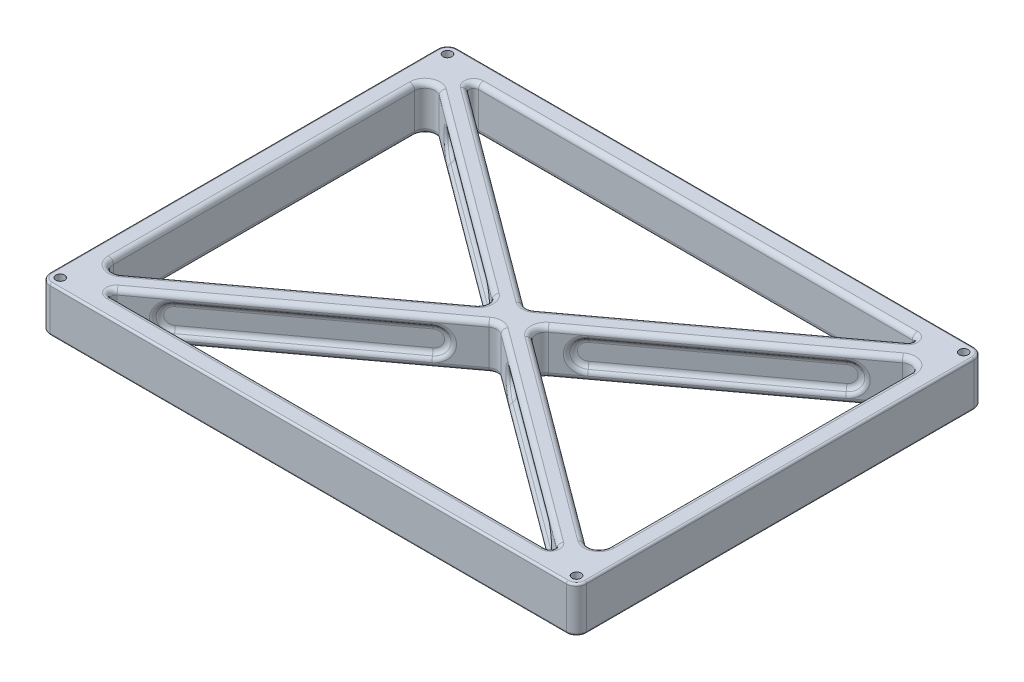
from build123d import *

# Parameters (mm, degrees)
SKETCH1_W           = 264
SKETCH1_H           = 200.50000000000003
SKETCH1_R           = 2.200000000000014
SKETCH1_R_2         = 2.1999999999999966
SKETCH1_W_2         = 244
SKETCH1_H_2         = 180.49999999999997
BOSS_EXTRUDE1_DEPTH = 22.2504
FILLET1_R           = 5
FILLET2_R           = 1
FILLET4_R           = 2.25
FILLET3_R           = 2.5
CUT_EXTRUDE3_DEPTH  = 2.5
CUT_EXTRUDE4_START  = -7.5
CUT_EXTRUDE4_DEPTH  = 2.5
CUT_EXTRUDE5_DEPTH  = 2.5
CUT_EXTRUDE6_START  = -7.5
CUT_EXTRUDE6_DEPTH  = 2.5
FILLET6_R           = 2.5
FILLET7_R           = 3


# Some blends are built 0.0001 mm under size
with BuildPart() as part:
    # Sketch1 → Boss-Extrude1 (new body)
    # profile 1 of 6: a face of its own
    with BuildSketch(Plane(origin=(0, 0, 0), x_dir=(1, 0, 0), z_dir=(0, 1, 0))):
        Rectangle(SKETCH1_W, SKETCH1_H)
        with Locations(Location((-127.00000000000003, 95.24999999999997, 0), (0, 0, 90))):
            Circle(SKETCH1_R, mode=Mode.SUBTRACT)
        with Locations(Location((126.99999999999997, 95.25, 0), (0, 0, 90))):
            Circle(SKETCH1_R, mode=Mode.SUBTRACT)
        with Locations(Location((126.99999999999997, -95.24999999999997, 0), (0, 0, 90))):
            Circle(SKETCH1_R, mode=Mode.SUBTRACT)
        with Locations(Location((-127.00000000000003, -95.25, 0), (0, 0, 90))):
            Circle(SKETCH1_R_2, mode=Mode.SUBTRACT)
        Rectangle(SKETCH1_W_2, SKETCH1_H_2, mode=Mode.SUBTRACT)
    # profile 2 of 6: a face of its own
    with BuildSketch(Plane(origin=(0, 0, 0), x_dir=(1, 0, 0), z_dir=(0, 1, 0))):
        Polygon((-121.99999999999999, 90.25), (-121.99999999999999, 84.0306026697892), (-8.40738475662856, 1.1369e-13), (-1.421e-14, 6.219397330210882), (-113.59261524337134, 90.24999999999999), align=None)
    # profile 3 of 6: a face of its own
    with BuildSketch(Plane(origin=(0, 0, 0), x_dir=(1, 0, 0), z_dir=(0, 1, 0))):
        Polygon((8.40738475662856, -2.842e-14), (9.948e-14, -6.219397330210853), (113.59261524337164, -90.24999999999999), (122.00000000000003, -90.24999999999997), (122.00000000000003, -84.03060266978919), align=None)
    # profile 4 of 6: a face of its own
    with BuildSketch(Plane(origin=(0, 0, 0), x_dir=(1, 0, 0), z_dir=(0, 1, 0))):
        Polygon((9.948e-14, -6.219397330210825), (-8.40738475662856, 1.1369e-13), (-121.99999999999999, -84.03060266978906), (-121.99999999999999, -90.24999999999997), (-113.59261524337128, -90.24999999999997), align=None)
    # profile 5 of 6: a face of its own
    with BuildSketch(Plane(origin=(0, 0, 0), x_dir=(1, 0, 0), z_dir=(0, 1, 0))):
        Polygon((113.59261524337147, 90.25), (-1.421e-14, 6.219397330210882), (8.407384756628616, -4.263e-14), (122.00000000000001, 84.03060266978915), (122.00000000000003, 90.25), align=None)
    # profile 6 of 6: a face of its own
    with BuildSketch(Plane(origin=(0, 0, 0), x_dir=(1, 0, 0), z_dir=(0, 1, 0))):
        Polygon((-1.421e-14, 6.219397330210882), (-8.407384756628531, 2.842e-14), (9.948e-14, -6.219397330210825), (8.40738475662856, -2.842e-14), align=None)
    extrude(amount=BOSS_EXTRUDE1_DEPTH)

    # Fillet1
    fillet1_edges = [part.edges().sort_by_distance(p)[0] for p in [
        (-132, 11.1252, -100.25),
        (132, 11.1252, -100.25),
        (132, 11.1252, 100.25),
        (-132, 11.1252, 100.25),
        (122.00000000000003, 11.1252, 84.03060266978919),
        (122.00000000000003, 11.1252, -84.03060266978915),
        (8.407384756628588, 11.1252, 3.553e-14),
        (7.11e-15, 11.1252, -6.2193973302108745),
        (-121.99999999999999, 11.1252, -84.0306026697892),
        (-121.99999999999999, 11.1252, 84.03060266978906),
        (-8.407384756628545, 11.1252, -7.105e-14),
        (9.948e-14, 11.1252, 6.219397330210839),
    ]]
    fillet(fillet1_edges, radius=FILLET1_R)

    # Fillet2
    fillet2_edges = [part.edges().sort_by_distance(p)[0] for p in [
        (-132, 0, 0),
        (-132, 22.2504, 0),
        (0, 0, -100.25),
        (132, 0, 0),
        (0, 0, 100.25),
        (-130.53553390593274, 0, 98.78553390593274),
        (130.53553390593274, 0, 98.78553390593274),
        (130.53553390593274, 0, -98.78553390593274),
        (-130.53553390593274, 0, -98.78553390593274),
        (0, 22.2504, -100.25),
        (0, 22.2504, 100.25),
        (132, 22.2504, 0),
        (-130.53553390593274, 22.2504, 98.78553390593274),
        (130.53553390593274, 22.2504, 98.78553390593274),
        (130.53553390593274, 22.2504, -98.78553390593274),
        (-130.53553390593274, 22.2504, -98.78553390593274),
    ]]
    fillet(fillet2_edges, radius=FILLET2_R)

    # Fillet4
    fillet4_edges = [part.edges().sort_by_distance(p)[0] for p in [
        (113.59261524337147, 11.1252, -90.25),
        (-113.59261524337134, 11.1252, -90.25),
        (-113.59261524337128, 11.1252, 90.24999999999997),
        (113.59261524337164, 11.1252, 90.24999999999997),
    ]]
    fillet(fillet4_edges, radius=FILLET4_R)

    # Fillet3
    fillet3_edges = [part.edges().sort_by_distance(p)[0] for p in [
        (1.4288e-13, 22.2504, 7.438794660421738),
        (-11.814769513257094, 0, -5.125e-14),
        (-11.814769513257094, 22.2504, -5.125e-14),
        (-2.225e-14, 0, -7.438794660421792),
        (-2.225e-14, 22.2504, -7.438794660421792),
        (119.25079080925714, 0, 78.57717904346684),
        (119.25079080925714, 22.2504, 78.57717904346684),
        (-119.25079080925708, 0, 78.57717904346667),
        (-119.25079080925708, 22.2504, 78.57717904346667),
        (119.25079080925715, 0, -78.5771790434668),
        (119.25079080925715, 22.2504, -78.5771790434668),
        (-119.25079080925708, 0, -78.57717904346683),
        (-119.25079080925708, 22.2504, -78.57717904346683),
        (1.279e-13, 0, 90.24999999999997),
        (1.279e-13, 22.2504, 90.24999999999997),
        (-55.539713240734955, 0, 47.3051278218202),
        (-55.539713240734955, 22.2504, 47.3051278218202),
        (55.53971324073509, 0, -47.305127821820236),
        (55.53971324073509, 22.2504, -47.305127821820236),
        (2.842e-14, 0, -90.25),
        (2.842e-14, 22.2504, -90.25),
        (108.9046110099341, 0, 88.70447565375049),
        (108.9046110099341, 22.2504, 88.70447565375049),
        (-108.90461100993383, 0, 88.70447565375048),
        (-108.90461100993383, 22.2504, 88.70447565375048),
        (108.90461100993397, 0, -88.7044756537505),
        (108.90461100993397, 22.2504, -88.7044756537505),
        (-108.9046110099339, 0, -88.70447565375054),
        (-108.9046110099339, 22.2504, -88.70447565375054),
        (63.933808463443114, 0, -41.07589950442634),
        (63.933808463443114, 22.2504, -41.07589950442634),
        (63.93380846344311, 0, 41.07589950442636),
        (63.93380846344311, 22.2504, 41.07589950442636),
        (55.53971324073523, 0, 47.3051278218202),
        (55.53971324073523, 22.2504, 47.3051278218202),
        (-63.933808463443036, 0, 41.07589950442625),
        (-63.933808463443036, 22.2504, 41.07589950442625),
        (-63.93380846344305, 0, -41.07589950442639),
        (-63.93380846344305, 22.2504, -41.07589950442639),
        (-55.539713240735054, 0, -47.30512782182024),
        (-55.539713240735054, 22.2504, -47.30512782182024),
        (122.00000000000003, 0, 2.842e-14),
        (122.00000000000003, 22.2504, 2.842e-14),
        (-121.99999999999999, 0, -7.105e-14),
        (-121.99999999999999, 22.2504, -7.105e-14),
        (11.814769513257168, 0, -1.169e-14),
        (11.814769513257168, 22.2504, -1.169e-14),
        (1.4288e-13, 0, 7.438794660421738),
    ]]
    fillet(fillet3_edges, radius=FILLET3_R)

    # Sketch3 → Cut-Extrude3 (cut)
    with BuildSketch(Plane(origin=(-2.973576293185441, 0, 4.019682080538768), x_dir=(0.8039364161077707, 0, 0.5947152586371007), z_dir=(-0.5947152586371007, 0, 0.8039364161077707))):
        with BuildLine():
            Line((-118.13635654332894, 4.999999999999997), (-27.397540983606554, 5.000000000000006))
            ThreePointArc((-27.397540983606554, 5.000000000000006), (-21.27234098360655, 11.12520000000001), (-27.397540983606554, 17.250400000000017))
            Line((-27.397540983606554, 17.250400000000017), (-118.13635654332894, 17.250400000000003))
            ThreePointArc((-118.13635654332894, 17.250400000000003), (-124.26155654332895, 11.1252), (-118.13635654332894, 4.999999999999997))
        make_face()
        with BuildLine():
            Line((27.397540983606568, 4.999999999999997), (118.16941770004311, 5.000000000000013))
            ThreePointArc((118.16941770004311, 5.000000000000013), (124.2946177000431, 11.12520000000001), (118.16941770004311, 17.25040000000001))
            Line((118.16941770004311, 17.25040000000001), (27.397540983606568, 17.250400000000003))
            ThreePointArc((27.397540983606568, 17.250400000000003), (21.272340983606565, 11.1252), (27.397540983606568, 4.999999999999997))
        make_face()
    extrude(amount=-CUT_EXTRUDE3_DEPTH, mode=Mode.SUBTRACT)

    # Sketch3<3> → Cut-Extrude4 (cut)
    with BuildSketch(Plane(origin=(-2.973576293185441, 0, 4.019682080538768), x_dir=(0.8039364161077707, 0, 0.5947152586371007), z_dir=(-0.5947152586371007, 0, 0.8039364161077707)).offset(CUT_EXTRUDE4_START)):
        with BuildLine():
            Line((-118.13635654332894, 4.999999999999997), (-27.397540983606554, 5.000000000000006))
            ThreePointArc((-27.397540983606554, 5.000000000000006), (-21.27234098360655, 11.12520000000001), (-27.397540983606554, 17.250400000000017))
            Line((-27.397540983606554, 17.250400000000017), (-118.13635654332894, 17.250400000000003))
            ThreePointArc((-118.13635654332894, 17.250400000000003), (-124.26155654332895, 11.1252), (-118.13635654332894, 4.999999999999997))
        make_face()
        with BuildLine():
            Line((27.397540983606568, 4.999999999999997), (118.16941770004311, 5.000000000000013))
            ThreePointArc((118.16941770004311, 5.000000000000013), (124.2946177000431, 11.12520000000001), (118.16941770004311, 17.25040000000001))
            Line((118.16941770004311, 17.25040000000001), (27.397540983606568, 17.250400000000003))
            ThreePointArc((27.397540983606568, 17.250400000000003), (21.272340983606565, 11.1252), (27.397540983606568, 4.999999999999997))
        make_face()
    extrude(amount=-CUT_EXTRUDE4_DEPTH, mode=Mode.SUBTRACT)

    # Sketch4 → Cut-Extrude5 (cut)
    with BuildSketch(Plane(origin=(-2.973576293185498, 0, -4.019682080538846), x_dir=(-0.8039364161077704, 0, 0.5947152586371007), z_dir=(-0.5947152586371008, 0, -0.8039364161077706))):
        with BuildLine():
            Line((-27.397540983606525, 17.250400000000003), (-118.16941770004307, 17.250400000000003))
            ThreePointArc((-118.16941770004307, 17.250400000000003), (-124.29461770004309, 11.125199999999987), (-118.16941770004307, 4.999999999999997))
            Line((-118.16941770004307, 4.999999999999997), (-27.397540983606525, 4.999999999999997))
            ThreePointArc((-27.397540983606525, 4.999999999999997), (-21.272340983606522, 11.125200000000001), (-27.397540983606525, 17.250400000000003))
        make_face()
        with BuildLine():
            Line((27.397540983606458, 5.000000000000006), (118.13635654332884, 5.000000000000019))
            ThreePointArc((118.13635654332884, 5.000000000000019), (124.26155654332884, 11.125200000000017), (118.13635654332884, 17.250400000000017))
            Line((118.13635654332884, 17.250400000000017), (27.397540983606458, 17.250400000000006))
            ThreePointArc((27.397540983606458, 17.250400000000006), (21.272340983606455, 11.125200000000005), (27.397540983606458, 5.000000000000006))
        make_face()
    extrude(amount=-CUT_EXTRUDE5_DEPTH, mode=Mode.SUBTRACT)

    # Sketch4<3> → Cut-Extrude6 (cut)
    with BuildSketch(Plane(origin=(-2.973576293185498, 0, -4.019682080538846), x_dir=(-0.8039364161077704, 0, 0.5947152586371007), z_dir=(-0.5947152586371008, 0, -0.8039364161077706)).offset(CUT_EXTRUDE6_START)):
        with BuildLine():
            Line((-27.397540983606525, 17.250400000000003), (-118.16941770004307, 17.250400000000003))
            ThreePointArc((-118.16941770004307, 17.250400000000003), (-124.29461770004309, 11.125199999999987), (-118.16941770004307, 4.999999999999997))
            Line((-118.16941770004307, 4.999999999999997), (-27.397540983606525, 4.999999999999997))
            ThreePointArc((-27.397540983606525, 4.999999999999997), (-21.272340983606522, 11.125200000000001), (-27.397540983606525, 17.250400000000003))
        make_face()
        with BuildLine():
            Line((27.397540983606458, 5.000000000000006), (118.13635654332884, 5.000000000000019))
            ThreePointArc((118.13635654332884, 5.000000000000019), (124.26155654332884, 11.125200000000017), (118.13635654332884, 17.250400000000017))
            Line((118.13635654332884, 17.250400000000017), (27.397540983606458, 17.250400000000006))
            ThreePointArc((27.397540983606458, 17.250400000000006), (21.272340983606455, 11.125200000000005), (27.397540983606458, 5.000000000000006))
        make_face()
    extrude(amount=-CUT_EXTRUDE6_DEPTH, mode=Mode.SUBTRACT)

    # Fillet6
    fillet6_edges = [part.edges().sort_by_distance(p)[0] for p in [
        (-55.52642370681444, 17.250400000000013, 47.295296834637185),
        (-96.92481413423135, 11.125200000000017, 77.9199258188534),
        (-55.52642370681444, 5.000000000000012, 47.295296834637185),
        (55.53971324073519, 17.250400000000006, 47.30512782182021),
        (96.95139320207268, 11.12520000000001, 77.93958779321946),
        (55.53971324073518, 5.000000000000005, 47.30512782182019),
        (-61.473576293185445, 17.250400000000013, 39.255932673559485),
        (-102.87196672060237, 11.125200000000017, 69.8805616577757),
        (-61.473576293185445, 5.000000000000012, 39.255932673559485),
        (-61.47357629318548, 5.000000000000002, -39.25593267355961),
        (-102.87196672060242, 11.1252, -69.88056165777583),
        (-61.47357629318548, 17.25040000000001, -39.25593267355961),
        (-55.52642370681448, 5.000000000000002, -47.29529683463733),
        (-96.9248141342314, 11.1252, -77.91992581885354),
        (-55.52642370681448, 17.25040000000001, -47.29529683463733),
        (61.486865827106094, 4.999999999999997, -39.265763660742564),
        (102.89854578844363, 11.125200000000001, -69.90022363214185),
        (61.486865827106094, 17.250400000000003, -39.265763660742564),
        (55.53971324073509, 4.999999999999997, -47.305127821820264),
        (96.95139320207261, 11.125200000000001, -77.93958779321954),
        (55.53971324073509, 17.250400000000003, -47.305127821820264),
        (20.075185865768677, 11.1252, 8.631303689343238),
        (61.486865827106186, 5.000000000000005, 39.26576366074249),
        (102.8985457884437, 11.12520000000001, 69.90022363214175),
        (-14.128033279397512, 11.125200000000007, 16.670667850420976),
        (14.12803327939767, 11.1252, 16.670667850420944),
        (-20.07518586576852, 11.125200000000007, 8.63130368934327),
        (-20.075185865768542, 11.12520000000001, -8.6313036893434),
        (-14.128033279397535, 11.12520000000001, -16.670667850421104),
        (20.07518586576858, 11.1252, -8.631303689343293),
        (14.128033279397574, 11.1252, -16.670667850420998),
        (61.48686582710619, 17.250400000000006, 39.26576366074251),
    ]]
    fillet(fillet6_edges, radius=FILLET6_R - 0.0001)  # a hair under: the kernel refuses the full size

    # Fillet7
    # the kernel refuses this fillet: 3 mm, written as the material it adds along each edge
    with BuildSketch(Plane(origin=(-96.46090723806634, 4.999999999999997, -68.24765279584129), x_dir=(-0.5701467288895418, -0.28445772948515635, 0.7707246639836466), z_dir=(0.8039364161077707, 0, 0.5947152586371007))) as fillet7_piece_1:
        with BuildLine():
            CenterArc((2.2759117138170812, -2.876031614211566), FILLET7_R, 106.52872897357935, 56.94483382122908)
            Line((-0.6001540366874873, -2.0226584257561595), (-0.8877606117379461, -1.937321106910618))
            Line((-0.8877606117379461, -1.937321106910618), (-0.287606575050457, 0.08533731884554728))
            Line((-0.287606575050457, 0.08533731884554728), (0.0853373188455359, 0.28760657505045895))
            ThreePointArc((0.0853373188455359, 0.28760657505045895), (0.08543318770390149, 0.2875781292775039), (1.3370746638412714, 0.2876031614211559))
            Line((1.3370746638412714, 0.2876031614211559), (1.4224234865663412, 2e-17))
        make_face()
    extrude(amount=90.7388155597224)
    with BuildSketch(Plane(origin=(-96.46090723806634, 11.1252, -68.24765279584129), x_dir=(0, 1, 0), z_dir=(0.8039364161077707, 0, 0.5947152586371007))) as fillet7_piece_2:
        with BuildLine():
            CenterArc((4.015382004286984, 2.999999999999964), FILLET7_R, 269.9999999999988, 56.94483382122911)
            Line((4.015382004286922, -3.975e-14), (4.015382004286906, -0.30000000000004107))
            Line((4.015382004286906, -0.30000000000004107), (6.125200000000007, -0.30000000000000127))
            Line((6.125200000000007, -0.30000000000000127), (6.425200000000004, 0))
            ThreePointArc((6.425200000000004, 0), (6.425199999999993, 0.0001000000000052), (6.78126309046181, 1.2000272732231438))
            Line((6.78126309046181, 1.2000272732231438), (6.529819355355009, 1.3636611574755753))
        make_face()
    revolve(axis=Axis((-96.46090723806634, 11.1252, -68.24765279584129), (-0.5947152586371007, 0, 0.8039364161077707)), revolution_arc=180)
    with BuildSketch(Plane(origin=(-23.512669055119105, 11.12520000000001, -14.283894631816798), x_dir=(0, -1, 0), z_dir=(-0.8039364161077707, 0, -0.5947152586371007))) as fillet7_piece_3:
        with BuildLine():
            CenterArc((4.015382004287026, 2.9999999999999662), FILLET7_R, 269.99999999999886, 56.944833821228826)
            Line((4.015382004286967, -3.553e-14), (4.015382004286963, -0.3000000000000375))
            Line((4.015382004286963, -0.3000000000000375), (6.125200000000003, -0.29999999999999777))
            Line((6.125200000000003, -0.29999999999999777), (6.425200000000004, 2.8e-15))
            ThreePointArc((6.425200000000004, 2.8e-15), (6.425200000000013, 9.999999999383e-05), (6.781263090461841, 1.200027273223129))
            Line((6.781263090461841, 1.200027273223129), (6.529819355355039, 1.3636611574755704))
        make_face()
    revolve(axis=Axis((-23.512669055119105, 11.12520000000001, -14.283894631816798), (-0.5947152586371007, 0, 0.8039364161077707)), revolution_arc=180)
    with BuildSketch(Plane(origin=(-23.512669055119105, 17.250400000000017, -14.2838946318168), x_dir=(-0.570146728889541, 0.2844577294851615, 0.7707246639836454), z_dir=(-0.8039364161077707, 0, -0.5947152586371007))) as fillet7_piece_4:
        with BuildLine():
            CenterArc((2.275911713817071, -2.8760316142115667), FILLET7_R, 106.52872897357922, 56.944833821228954)
            Line((-0.6001540366875023, -2.022658425756145), (-0.8877606117379554, -1.9373211069106044))
            Line((-0.8877606117379554, -1.9373211069106044), (-0.2876065750504511, 0.0853373188455472))
            Line((-0.2876065750504511, 0.0853373188455472), (0.08533731884554865, 0.28760657505045606))
            ThreePointArc((0.08533731884554865, 0.28760657505045606), (0.08543318770389974, 0.28757812927750726), (1.337074663841262, 0.2876031614211566))
            Line((1.337074663841262, 0.2876031614211566), (1.4224234865663377, -2e-17))
        make_face()
    extrude(amount=90.7388155597224)
    with BuildSketch(Plane(origin=(20.539092761933745, 4.999999999999997, 18.303576712355486), x_dir=(-0.5701467288895403, -0.28445772948516385, 0.7707246639836448), z_dir=(0.8039364161077707, 0, 0.5947152586371007))) as fillet7_piece_5:
        with BuildLine():
            CenterArc((2.275911713817056, -2.876031614211568), FILLET7_R, 106.52872897357928, 56.94483382122873)
            Line((-0.6001540366875102, -2.022658425756138), (-0.8877606117379724, -1.9373211069105938))
            Line((-0.8877606117379724, -1.9373211069105938), (-0.28760657505045345, 0.08533731884554867))
            Line((-0.28760657505045345, 0.08533731884554867), (0.08533731884554649, 0.2876065750504557))
            ThreePointArc((0.08533731884554649, 0.2876065750504557), (0.08543318770386897, 0.2875781292775154), (1.3370746638412445, 0.2876031614211567))
            Line((1.3370746638412445, 0.2876031614211567), (1.4224234865663195, 0))
        make_face()
    extrude(amount=90.77187671643657)
    with BuildSketch(Plane(origin=(20.539092761933745, 11.1252, 18.303576712355486), x_dir=(0, 1, 0), z_dir=(0.8039364161077707, 0, 0.5947152586371007))) as fillet7_piece_6:
        with BuildLine():
            CenterArc((4.015382004287021, 2.999999999999962), FILLET7_R, 269.9999999999987, 56.944833821228826)
            Line((4.015382004286954, -4.05e-14), (4.015382004286948, -0.30000000000004107))
            Line((4.015382004286948, -0.30000000000004107), (6.125200000000007, -0.29999999999999843))
            Line((6.125200000000007, -0.29999999999999843), (6.425200000000004, 2.11e-15))
            ThreePointArc((6.425200000000004, 2.11e-15), (6.425200000000004, 9.999999997824e-05), (6.781263090461831, 1.2000272732231196))
            Line((6.781263090461831, 1.2000272732231196), (6.5298193553550306, 1.363661157475559))
        make_face()
    revolve(axis=Axis((20.539092761933745, 11.1252, 18.303576712355486), (-0.5947152586371007, 0, 0.8039364161077707)), revolution_arc=180)
    with BuildSketch(Plane(origin=(93.51391001272214, 11.12520000000001, 72.28699685074606), x_dir=(0, -1, 0), z_dir=(-0.8039364161077707, 0, -0.5947152586371007))) as fillet7_piece_7:
        with BuildLine():
            CenterArc((4.015382004287034, 2.999999999999964), FILLET7_R, 269.99999999999886, 56.94483382122871)
            Line((4.015382004286973, -3.13e-14), (4.015382004286968, -0.30000000000004107))
            Line((4.015382004286968, -0.30000000000004107), (6.125199999999979, -0.30000000000000127))
            Line((6.125199999999979, -0.30000000000000127), (6.425199999999986, 0))
            ThreePointArc((6.425199999999986, 0), (6.425200000000004, 9.999999996544e-05), (6.781263090461842, 1.2000272732231239))
            Line((6.781263090461842, 1.2000272732231239), (6.529819355355037, 1.3636611574755668))
        make_face()
    revolve(axis=Axis((93.51391001272214, 11.12520000000001, 72.28699685074606), (-0.5947152586371007, 0, 0.8039364161077707)), revolution_arc=180)
    with BuildSketch(Plane(origin=(93.51391001272214, 17.25040000000001, 72.28699685074606), x_dir=(-0.5701467288895395, 0.2844577294851694, 0.7707246639836436), z_dir=(-0.8039364161077707, 0, -0.5947152586371007))) as fillet7_piece_8:
        with BuildLine():
            CenterArc((2.275911713817041, -2.876031614211573), FILLET7_R, 106.5287289735789, 56.944833821228684)
            Line((-0.6001540366875294, -2.0226584257561204), (-0.8877606117379759, -1.9373211069105776))
            Line((-0.8877606117379759, -1.9373211069105776), (-0.2876065750504449, 0.08533731884554793))
            Line((-0.2876065750504449, 0.08533731884554793), (0.08533731884556198, 0.2876065750504521))
            ThreePointArc((0.08533731884556198, 0.2876065750504521), (0.08543318770387899, 0.2875781292775135), (1.3370746638412407, 0.2876031614211601))
            Line((1.3370746638412407, 0.2876031614211601), (1.4224234865663232, 0))
        make_face()
    extrude(amount=90.77187671643655)
    with BuildSketch(Plane(origin=(-20.539092761933603, 17.250400000000017, -18.30357671235565), x_dir=(0.5701467288895351, 0.2844577294851935, -0.7707246639836378), z_dir=(-0.8039364161077707, 0, -0.5947152586371007))) as fillet7_piece_9:
        with BuildLine():
            CenterArc((2.275911713816984, 2.8760316142115765), FILLET7_R, 196.52643720519384, 56.94483382122746)
            Line((-0.6001540366875592, 2.022658425756054), (-0.8877606117380142, 1.9373211069105005))
            Line((-0.8877606117380142, 1.9373211069105005), (-0.2876065750504496, -0.0853373188455572))
            Line((-0.2876065750504496, -0.0853373188455572), (0.08533731884555681, -0.2876065750504536))
            ThreePointArc((0.08533731884555681, -0.2876065750504536), (0.0854331877037962, -0.287578129277538), (1.3370746638412052, -0.2876031614211576))
            Line((1.3370746638412052, -0.2876031614211576), (1.4224234865662775, 3e-17))
        make_face()
    extrude(amount=90.73881555972238)
    with BuildSketch(Plane(origin=(-93.48733094488084, 11.1252, -72.26733487638013), x_dir=(0, 1, 0), z_dir=(0.8039364161077707, 0, 0.5947152586371007))) as fillet7_piece_10:
        with BuildLine():
            CenterArc((4.015382004287067, -2.999999999999947), FILLET7_R, 33.055166178772865, 56.944833821228286)
            Line((4.015382004287007, 5.118e-14), (4.015382004287002, 0.30000000000006094))
            Line((4.015382004287002, 0.30000000000006094), (6.1251999999999995, 0.2999999999999983))
            Line((6.1251999999999995, 0.2999999999999983), (6.425200000000004, -2.97e-15))
            ThreePointArc((6.425200000000004, -2.97e-15), (6.425200000000029, -9.999999992866e-05), (6.7812630904618665, -1.2000272732230786))
            Line((6.7812630904618665, -1.2000272732230786), (6.5298193553550625, -1.36366115747553))
        make_face()
    revolve(axis=Axis((-93.48733094488084, 11.1252, -72.26733487638013), (-0.5947152586371007, 0, 0.8039364161077707)), revolution_arc=180)
    with BuildSketch(Plane(origin=(-93.48733094488084, 4.999999999999997, -72.26733487638013), x_dir=(0.5701467288895378, -0.28445772948517883, -0.7707246639836413), z_dir=(0.8039364161077707, 0, 0.5947152586371007))) as fillet7_piece_11:
        with BuildLine():
            CenterArc((2.275911713817026, 2.8760316142115765), FILLET7_R, 196.52643720519293, 56.94483382122792)
            Line((-0.600154036687544, 2.0226584257560964), (-0.8877606117379898, 1.9373211069105516))
            Line((-0.8877606117379898, 1.9373211069105516), (-0.287606575050455, -0.08533731884555401))
            Line((-0.287606575050455, -0.08533731884555401), (0.0853373188455536, -0.28760657505045367))
            ThreePointArc((0.0853373188455536, -0.28760657505045367), (0.08543318770382916, -0.2875781292775254), (1.3370746638412256, -0.2876031614211568))
            Line((1.3370746638412256, -0.2876031614211568), (1.4224234865662946, 3e-17))
        make_face()
    extrude(amount=90.7388155597224)
    with BuildSketch(Plane(origin=(-20.539092761933603, 11.12520000000001, -18.30357671235565), x_dir=(0, -1, 0), z_dir=(-0.8039364161077707, 0, -0.5947152586371007))) as fillet7_piece_12:
        with BuildLine():
            CenterArc((4.015382004287079, -2.999999999999963), FILLET7_R, 33.05516617877372, 56.94483382122765)
            Line((4.015382004287008, 3.838e-14), (4.015382004286999, 0.30000000000003896))
            Line((4.015382004286999, 0.30000000000003896), (6.125200000000001, 0.30000000000000204))
            Line((6.125200000000001, 0.30000000000000204), (6.425200000000002, 1.49e-15))
            ThreePointArc((6.425200000000002, 1.49e-15), (6.425199999999997, -9.999999988011e-05), (6.7812630904618505, -1.2000272732230621))
            Line((6.7812630904618505, -1.2000272732230621), (6.529819355355053, -1.3636611574755064))
        make_face()
    revolve(axis=Axis((-20.539092761933603, 11.12520000000001, -18.30357671235565), (-0.5947152586371007, 0, 0.8039364161077707)), revolution_arc=180)
    with BuildSketch(Plane(origin=(96.48748630590764, 17.25040000000001, 68.26731477020722), x_dir=(0.5701467288895319, 0.28445772948521225, -0.7707246639836333), z_dir=(-0.8039364161077707, 0, -0.5947152586371007))) as fillet7_piece_13:
        with BuildLine():
            CenterArc((2.27591171381696, 2.8760316142115827), FILLET7_R, 196.52643720519484, 56.94483382122684)
            Line((-0.6001540366875631, 2.022658425756012), (-0.887760611738017, 1.9373211069104546))
            Line((-0.887760611738017, 1.9373211069104546), (-0.2876065750504492, -0.08533731884556318))
            Line((-0.2876065750504492, -0.08533731884556318), (0.08533731884556672, -0.2876065750504507))
            ThreePointArc((0.08533731884556672, -0.2876065750504507), (0.08543318770374853, -0.2875781292775558), (1.3370746638412083, -0.28760316142115816))
            Line((1.3370746638412083, -0.28760316142115816), (1.422423486566271, -3e-17))
        make_face()
    extrude(amount=90.77187671643657)
    with BuildSketch(Plane(origin=(23.512669055119247, 11.1252, 14.283894631816635), x_dir=(0, 1, 0), z_dir=(0.8039364161077707, 0, 0.5947152586371007))) as fillet7_piece_14:
        with BuildLine():
            CenterArc((4.015382004287147, -2.9999999999999636), FILLET7_R, 33.05516617877395, 56.94483382122714)
            Line((4.0153820042870905, 3.695e-14), (4.015382004287083, 0.3000000000000396))
            Line((4.015382004287083, 0.3000000000000396), (6.125200000000007, 0.30000000000000054))
            Line((6.125200000000007, 0.30000000000000054), (6.425200000000004, 0))
            ThreePointArc((6.425200000000004, 0), (6.42520000000005, -9.999999986029e-05), (6.781263090461909, -1.2000272732230501))
            Line((6.781263090461909, -1.2000272732230501), (6.529819355355116, -1.3636611574754958))
        make_face()
    revolve(axis=Axis((23.512669055119247, 11.1252, 14.283894631816635), (-0.5947152586371007, 0, 0.8039364161077707)), revolution_arc=180)
    with BuildSketch(Plane(origin=(23.512669055119247, 4.999999999999997, 14.283894631816636), x_dir=(0.5701467288895347, -0.2844577294851966, -0.770724663983637), z_dir=(0.8039364161077707, 0, 0.5947152586371007))) as fillet7_piece_15:
        with BuildLine():
            CenterArc((2.2759117138169858, 2.8760316142115765), FILLET7_R, 196.52643720519396, 56.94483382122735)
            Line((-0.6001540366875582, 2.0226584257560467), (-0.8877606117380119, 1.9373211069104939))
            Line((-0.8877606117380119, 1.9373211069104939), (-0.2876065750504465, -0.0853373188455573))
            Line((-0.2876065750504465, -0.0853373188455573), (0.08533731884556035, -0.2876065750504517))
            ThreePointArc((0.08533731884556035, -0.2876065750504517), (0.08543318770379021, -0.28757812927753884), (1.3370746638412059, -0.28760316142115794))
            Line((1.3370746638412059, -0.28760316142115794), (1.4224234865662775, -3e-17))
        make_face()
    extrude(amount=90.77187671643657)
    with BuildSketch(Plane(origin=(96.48748630590764, 11.12520000000001, 68.26731477020722), x_dir=(0, -1, 0), z_dir=(-0.8039364161077707, 0, -0.5947152586371007))) as fillet7_piece_16:
        with BuildLine():
            CenterArc((4.015382004287094, -2.999999999999964), FILLET7_R, 33.0551661787743, 56.94483382122726)
            Line((4.015382004287012, 5.118e-14), (4.015382004286997, 0.30000000000004107))
            Line((4.015382004286997, 0.30000000000004107), (6.125199999999989, 0.30000000000000127))
            Line((6.125199999999989, 0.30000000000000127), (6.425199999999986, 0))
            ThreePointArc((6.425199999999986, 0), (6.425199999999977, -9.999999984321e-05), (6.781263090461843, -1.200027273223033))
            Line((6.781263090461843, -1.200027273223033), (6.529819355355047, -1.3636611574754844))
        make_face()
    revolve(axis=Axis((96.48748630590764, 11.12520000000001, 68.26731477020722), (-0.5947152586371007, 0, 0.8039364161077707)), revolution_arc=180)
    with BuildSketch(Plane(origin=(20.539092761933645, 17.250400000000003, -18.303576712355547), x_dir=(-0.5701467288895408, 0.28445772948516257, -0.770724663983645), z_dir=(0.8039364161077706, 0, -0.5947152586371008))) as fillet7_piece_17:
        with BuildLine():
            CenterArc((2.275911713817066, -2.8760316142115685), FILLET7_R, 106.52872897357922, 56.94483382122884)
            Line((-0.6001540366875081, -2.022658425756141), (-0.8877606117379611, -1.9373211069106002))
            Line((-0.8877606117379611, -1.9373211069106002), (-0.28760657505045095, 0.08533731884554752))
            Line((-0.28760657505045095, 0.08533731884554752), (0.08533731884555303, 0.2876065750504547))
            ThreePointArc((0.08533731884555303, 0.2876065750504547), (0.08543318770389458, 0.28757812927750875), (1.3370746638412567, 0.28760316142115666))
            Line((1.3370746638412567, 0.28760316142115666), (1.422423486566332, -2e-17))
        make_face()
    extrude(amount=90.77187671643655)
    with BuildSketch(Plane(origin=(20.53909276193364, 11.1252, -18.303576712355543), x_dir=(5.8e-16, -1, -5.8e-16), z_dir=(0.8039364161077706, 0, -0.5947152586371008))) as fillet7_piece_18:
        with BuildLine():
            CenterArc((4.015382004287029, 2.9999999999999516), FILLET7_R, 269.99999999999875, 56.94483382122894)
            Line((4.015382004286963, -4.806e-14), (4.015382004286958, -0.30000000000004934))
            Line((4.015382004286958, -0.30000000000004934), (6.125200000000001, -0.30000000000000404))
            Line((6.125200000000001, -0.30000000000000404), (6.425200000000002, -6.6e-16))
            ThreePointArc((6.425200000000002, -6.6e-16), (6.425200000000019, 9.999999998043e-05), (6.781263090461844, 1.2000272732231183))
            Line((6.781263090461844, 1.2000272732231183), (6.529819355355043, 1.3636611574755577))
        make_face()
    revolve(axis=Axis((20.53909276193364, 11.1252, -18.303576712355543), (-0.5947152586371008, 0, -0.8039364161077706)), revolution_arc=180.00000000000009)
    with BuildSketch(Plane(origin=(93.51391001272205, 11.125200000000001, -72.28699685074615), x_dir=(-4.64e-15, 1, 2.32e-15), z_dir=(-0.8039364161077706, -5.110144869806872e-15, 0.5947152586371008))) as fillet7_piece_19:
        with BuildLine():
            CenterArc((4.015382004286999, 2.999999999999938), FILLET7_R, 269.9999999999986, 56.94483382122911)
            Line((4.015382004286925, -5.774e-14), (4.01538200428692, -0.300000000000059))
            Line((4.01538200428692, -0.300000000000059), (6.125199999999998, -0.3000000000000097))
            Line((6.125199999999998, -0.3000000000000097), (6.425200000000006, -2.7e-16))
            ThreePointArc((6.425200000000006, -2.7e-16), (6.425199999999991, 9.999999996518e-05), (6.781263090461812, 1.200027273223095))
            Line((6.781263090461812, 1.200027273223095), (6.529819355355008, 1.3636611574755466))
        make_face()
    revolve(axis=Axis((93.51391001272205, 11.125200000000001, -72.28699685074615), (-0.5947152586371008, 0, -0.8039364161077706)), revolution_arc=180.00000000000054)
    with BuildSketch(Plane(origin=(93.51391001272202, 4.999999999999997, -72.28699685074614), x_dir=(-0.5701467288895399, -0.2844577294851681, -0.7707246639836437), z_dir=(-0.8039364161077706, 0, 0.5947152586371008))) as fillet7_piece_20:
        with BuildLine():
            CenterArc((2.275911713817045, -2.8760316142115676), FILLET7_R, 106.52872897357918, 56.94483382122854)
            Line((-0.600154036687516, -2.022658425756125), (-0.8877606117379628, -1.9373211069105836))
            Line((-0.8877606117379628, -1.9373211069105836), (-0.287606575050445, 0.08533731884554754))
            Line((-0.287606575050445, 0.08533731884554754), (0.08533731884555039, 0.2876065750504546))
            ThreePointArc((0.08533731884555039, 0.2876065750504546), (0.0854331877038562, 0.28757812927751836), (1.3370746638412498, 0.2876031614211544))
            Line((1.3370746638412498, 0.2876031614211544), (1.422423486566314, 0))
        make_face()
    extrude(amount=90.77187671643654)
    with BuildSketch(Plane(origin=(-23.512669055119083, 5.000000000000006, 14.283894631816665), x_dir=(-0.5701467288895415, -0.284457729485158, -0.7707246639836461), z_dir=(-0.8039364161077706, 0, 0.5947152586371008))) as fillet7_piece_21:
        with BuildLine():
            CenterArc((2.275911713817073, -2.8760316142115667), FILLET7_R, 106.52872897357929, 56.944833821229)
            Line((-0.6001540366875024, -2.022658425756152), (-0.8877606117379556, -1.9373211069106118))
            Line((-0.8877606117379556, -1.9373211069106118), (-0.28760657505045545, 0.08533731884554735))
            Line((-0.28760657505045545, 0.08533731884554735), (0.0853373188455433, 0.28760657505045667))
            ThreePointArc((0.0853373188455433, 0.28760657505045667), (0.08543318770389388, 0.2875781292775062), (1.3370746638412596, 0.28760316142115716))
            Line((1.3370746638412596, 0.28760316142115716), (1.422423486566336, 1e-17))
        make_face()
    extrude(amount=90.73881555972238)
    with BuildSketch(Plane(origin=(-23.512669055119087, 11.125200000000007, 14.283894631816667), x_dir=(0, 1, 0), z_dir=(-0.8039364161077706, 0, 0.5947152586371008))) as fillet7_piece_22:
        with BuildLine():
            CenterArc((4.0153820042870105, 2.9999999999999556), FILLET7_R, 269.99999999999875, 56.944833821229054)
            Line((4.015382004286945, -4.335e-14), (4.015382004286936, -0.30000000000004245))
            Line((4.015382004286936, -0.30000000000004245), (6.125200000000003, -0.3000000000000012))
            Line((6.125200000000003, -0.3000000000000012), (6.425200000000004, 1.43e-15))
            ThreePointArc((6.425200000000004, 1.43e-15), (6.4252, 9.999999999532e-05), (6.781263090461827, 1.2000272732231274))
            Line((6.781263090461827, 1.2000272732231274), (6.5298193553550234, 1.3636611574755668))
        make_face()
    revolve(axis=Axis((-23.512669055119087, 11.125200000000007, 14.283894631816667), (-0.5947152586371008, 0, -0.8039364161077706)), revolution_arc=180)
    with BuildSketch(Plane(origin=(-96.4609072380663, 11.125200000000017, 68.24765279584115), x_dir=(0, -1, 0), z_dir=(0.8039364161077706, 0, -0.5947152586371008))) as fillet7_piece_23:
        with BuildLine():
            CenterArc((4.015382004286982, 2.9999999999999725), FILLET7_R, 269.99999999999847, 56.944833821229565)
            Line((4.015382004286901, -3.975e-14), (4.015382004286886, -0.300000000000041))
            Line((4.015382004286886, -0.300000000000041), (6.125200000000008, -0.30000000000000127))
            Line((6.125200000000008, -0.30000000000000127), (6.425200000000006, 8.45e-15))
            ThreePointArc((6.425200000000006, 8.45e-15), (6.425199999999988, 0.00010000000004495), (6.781263090461802, 1.2000272732231636))
            Line((6.781263090461802, 1.2000272732231636), (6.529819355355002, 1.363661157475595))
        make_face()
    revolve(axis=Axis((-96.4609072380663, 11.125200000000017, 68.24765279584115), (-0.5947152586371008, 0, -0.8039364161077706)), revolution_arc=180)
    with BuildSketch(Plane(origin=(-96.4609072380663, 17.250400000000017, 68.24765279584115), x_dir=(-0.5701467288895434, 0.2844577294851473, -0.7707246639836487), z_dir=(0.8039364161077706, 0, -0.5947152586371008))) as fillet7_piece_24:
        with BuildLine():
            CenterArc((2.2759117138170937, -2.876031614211564), FILLET7_R, 106.52872897357949, 56.94483382122942)
            Line((-0.6001540366874959, -2.0226584257561777), (-0.8877606117379443, -1.9373211069106415))
            Line((-0.8877606117379443, -1.9373211069106415), (-0.2876065750504497, 0.08533731884554215))
            Line((-0.2876065750504497, 0.08533731884554215), (0.08533731884554155, 0.28760657505045817))
            ThreePointArc((0.08533731884554155, 0.28760657505045817), (0.08543318770391858, 0.28757812927750165), (1.3370746638412576, 0.2876031614211615))
            Line((1.3370746638412576, 0.2876031614211615), (1.422423486566346, -8e-17))
        make_face()
    extrude(amount=90.73881555972238)
    with BuildSketch(Plane(origin=(96.48748630590752, 4.999999999999997, -68.26731477020728), x_dir=(0.5701467288895403, -0.28445772948516596, 0.7707246639836443), z_dir=(-0.8039364161077706, 0, 0.5947152586371008))) as fillet7_piece_25:
        with BuildLine():
            CenterArc((2.275911713817058, 2.87603161421157), FILLET7_R, 196.5264372051921, 56.94483382122871)
            Line((-0.6001540366875053, 2.0226584257561355), (-0.8877606117379633, 1.9373211069105916))
            Line((-0.8877606117379633, 1.9373211069105916), (-0.28760657505045617, -0.08533731884555015))
            Line((-0.28760657505045617, -0.08533731884555015), (0.08533731884554974, -0.28760657505045484))
            ThreePointArc((0.08533731884554974, -0.28760657505045484), (0.08543318770388555, -0.28757812927750964), (1.3370746638412603, -0.28760316142115416))
            Line((1.3370746638412603, -0.28760316142115416), (1.4224234865663248, 0))
        make_face()
    extrude(amount=90.77187671643654)
    with BuildSketch(Plane(origin=(23.512669055119147, 11.1252, -14.28389463181669), x_dir=(5.8e-16, -1, -5.8e-16), z_dir=(0.8039364161077706, 0, -0.5947152586371008))) as fillet7_piece_26:
        with BuildLine():
            CenterArc((4.0153820042870185, -2.9999999999999623), FILLET7_R, 33.055166178772396, 56.944833821228755)
            Line((4.015382004286958, 3.647e-14), (4.015382004286953, 0.30000000000003846))
            Line((4.015382004286953, 0.30000000000003846), (6.125200000000002, 0.2999999999999991))
            Line((6.125200000000002, 0.2999999999999991), (6.425200000000002, -1.46e-15))
            ThreePointArc((6.425200000000002, -1.46e-15), (6.4251999999999985, -9.999999998113e-05), (6.781263090461831, -1.200027273223124))
            Line((6.781263090461831, -1.200027273223124), (6.5298193553550306, -1.3636611574755633))
        make_face()
    revolve(axis=Axis((23.512669055119147, 11.1252, -14.28389463181669), (-0.5947152586371008, 0, -0.8039364161077706)), revolution_arc=180.00000000000009)
    with BuildSketch(Plane(origin=(23.512669055119147, 17.250400000000003, -14.283894631816693), x_dir=(0.5701467288895398, 0.2844577294851683, 0.7707246639836437), z_dir=(0.8039364161077706, 0, -0.5947152586371008))) as fillet7_piece_27:
        with BuildLine():
            CenterArc((2.275911713817052, 2.876031614211572), FILLET7_R, 196.52643720519222, 56.94483382122877)
            Line((-0.6001540366875175, 2.022658425756129), (-0.8877606117379742, 1.9373211069105853))
            Line((-0.8877606117379742, 1.9373211069105853), (-0.28760657505045045, -0.08533731884554922))
            Line((-0.28760657505045045, -0.08533731884554922), (0.0853373188455507, -0.28760657505045545))
            ThreePointArc((0.0853373188455507, -0.28760657505045545), (0.08543318770388778, -0.2875781292775145), (1.3370746638412552, -0.28760316142115716))
            Line((1.3370746638412552, -0.28760316142115716), (1.4224234865663286, 6e-17))
        make_face()
    extrude(amount=90.77187671643655)
    with BuildSketch(Plane(origin=(96.48748630590755, 11.125200000000001, -68.26731477020729), x_dir=(-4.64e-15, 1, 2.32e-15), z_dir=(-0.8039364161077706, -5.110144869806872e-15, 0.5947152586371008))) as fillet7_piece_28:
        with BuildLine():
            CenterArc((4.015382004287059, -2.9999999999999507), FILLET7_R, 33.055166178772545, 56.944833821228606)
            Line((4.015382004287, 4.461e-14), (4.015382004286986, 0.3000000000000459))
            Line((4.015382004286986, 0.3000000000000459), (6.125200000000008, 0.30000000000000127))
            Line((6.125200000000008, 0.30000000000000127), (6.425200000000006, -2.7e-16))
            ThreePointArc((6.425200000000006, -2.7e-16), (6.425200000000027, -9.999999996571e-05), (6.78126309046186, -1.2000272732231045))
            Line((6.78126309046186, -1.2000272732231045), (6.529819355355063, -1.3636611574755473))
        make_face()
    revolve(axis=Axis((96.48748630590755, 11.125200000000001, -68.26731477020729), (-0.5947152586371008, 0, -0.8039364161077706)), revolution_arc=180.00000000000054)
    with BuildSketch(Plane(origin=(-93.4873309448808, 17.250400000000017, 72.26733487638), x_dir=(0.5701467288895424, 0.2844577294851535, 0.7707246639836473), z_dir=(0.8039364161077706, 0, -0.5947152586371008))) as fillet7_piece_29:
        with BuildLine():
            CenterArc((2.275911713817078, 2.8760316142115694), FILLET7_R, 196.5264372051915, 56.94483382122917)
            Line((-0.6001540366874946, 2.0226584257561657), (-0.8877606117379533, 1.9373211069106246))
            Line((-0.8877606117379533, 1.9373211069106246), (-0.28760657505044634, -0.08533731884554317))
            Line((-0.28760657505044634, -0.08533731884554317), (0.08533731884554625, -0.2876065750504568))
            ThreePointArc((0.08533731884554625, -0.2876065750504568), (0.0854331877039243, -0.2875781292775037), (1.3370746638412727, -0.2876031614211565))
            Line((1.3370746638412727, -0.2876031614211565), (1.42242348656634, -4e-17))
        make_face()
    extrude(amount=90.73881555972238)
    with BuildSketch(Plane(origin=(-20.53909276193358, 11.125200000000007, 18.303576712355518), x_dir=(0, 1, 0), z_dir=(-0.8039364161077706, 0, 0.5947152586371008))) as fillet7_piece_30:
        with BuildLine():
            CenterArc((4.0153820042870265, -2.999999999999959), FILLET7_R, 33.05516617877225, 56.944833821228904)
            Line((4.015382004286966, 4.05e-14), (4.015382004286963, 0.3000000000000389))
            Line((4.015382004286963, 0.3000000000000389), (6.1251999999999995, 0.30000000000000115))
            Line((6.1251999999999995, 0.30000000000000115), (6.425200000000004, -1.2e-16))
            ThreePointArc((6.425200000000004, -1.2e-16), (6.425200000000018, -9.999999999612e-05), (6.781263090461842, -1.2000272732231312))
            Line((6.781263090461842, -1.2000272732231312), (6.529819355355041, -1.3636611574755677))
        make_face()
    revolve(axis=Axis((-20.53909276193358, 11.125200000000007, 18.303576712355518), (-0.5947152586371008, 0, -0.8039364161077706)), revolution_arc=180)
    with BuildSketch(Plane(origin=(-20.53909276193358, 5.000000000000006, 18.303576712355518), x_dir=(0.5701467288895419, -0.28445772948515596, 0.7707246639836467), z_dir=(-0.8039364161077706, 0, 0.5947152586371008))) as fillet7_piece_31:
        with BuildLine():
            CenterArc((2.2759117138170732, 2.8760316142115667), FILLET7_R, 196.52643720519157, 56.944833821229054)
            Line((-0.600154036687504, 2.022658425756158), (-0.8877606117379573, 1.9373211069106187))
            Line((-0.8877606117379573, 1.9373211069106187), (-0.2876065750504501, -0.08533731884554512))
            Line((-0.2876065750504501, -0.08533731884554512), (0.08533731884554817, -0.2876065750504553))
            ThreePointArc((0.08533731884554817, -0.2876065750504553), (0.08543318770389519, -0.2875781292775077), (1.337074663841258, -0.28760316142115655))
            Line((1.337074663841258, -0.28760316142115655), (1.4224234865663308, -4e-17))
        make_face()
    extrude(amount=90.7388155597224)
    with BuildSketch(Plane(origin=(-93.4873309448808, 11.125200000000017, 72.26733487638), x_dir=(0, -1, 0), z_dir=(0.8039364161077706, 0, -0.5947152586371008))) as fillet7_piece_32:
        with BuildLine():
            CenterArc((4.015382004286966, -2.9999999999999556), FILLET7_R, 33.055166178771884, 56.94483382122951)
            Line((4.015382004286893, 5.118e-14), (4.015382004286888, 0.300000000000041))
            Line((4.015382004286888, 0.300000000000041), (6.125199999999999, 0.29999999999998983))
            Line((6.125199999999999, 0.29999999999998983), (6.425200000000006, 8.45e-15))
            ThreePointArc((6.425200000000006, 8.45e-15), (6.425199999999986, -0.00010000000000817), (6.781263090461807, -1.2000272732231467))
            Line((6.781263090461807, -1.2000272732231467), (6.529819355354994, -1.3636611574755781))
        make_face()
    revolve(axis=Axis((-93.4873309448808, 11.125200000000017, 72.26733487638), (-0.5947152586371008, 0, -0.8039364161077706)), revolution_arc=180)


solid = part.part
